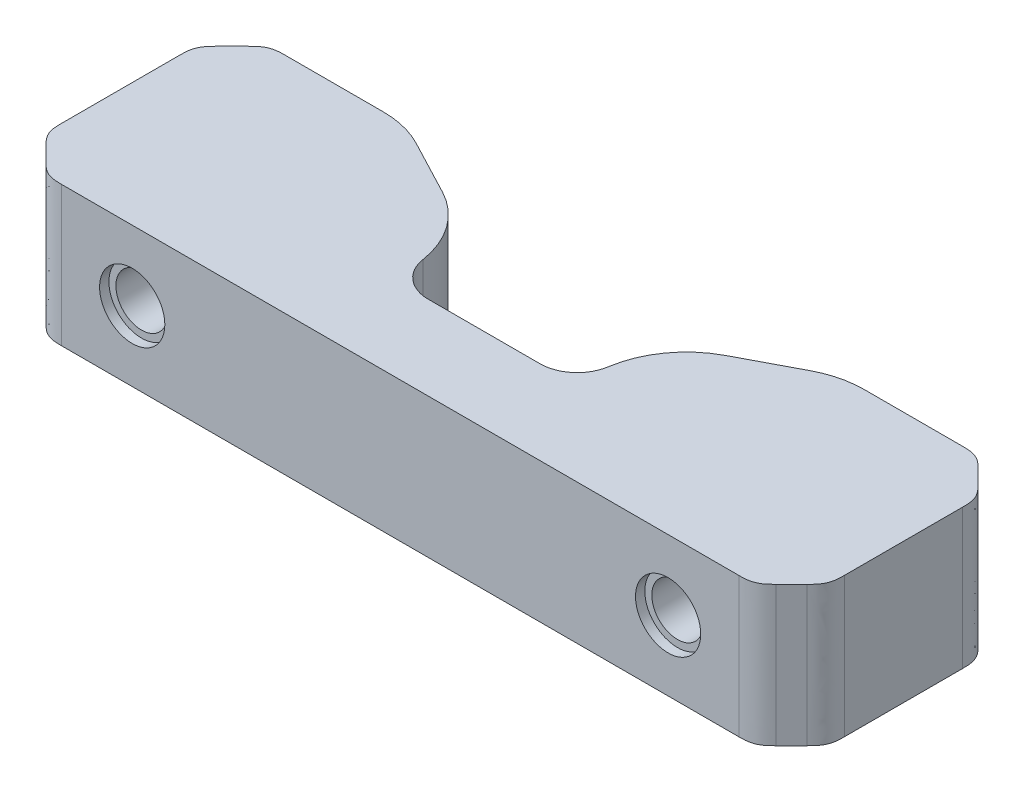
from build123d import *

# Parameters (mm, degrees)
ESQUISSE1_W                  = 20
ESQUISSE1_H                  = 12
BOSS_EXTRU_1_DEPTH           = 15
ESQUISSE1_4_R                = 4.2
ENL_V_MAT_EXTRU_1_DEPTH      = 12
CONG_2_R                     = 4
ENL_V_MAT_EXTRU_2_DEPTH      = 54.749418763
ENL_V_MAT_EXTRU_2_DEPTH_BACK = 10
ESQUISSE2_R                  = 2.75
ESQUISSE4_R                  = 3.5
ENL_V_MAT_EXTRU_3_DEPTH      = 1
ESQUISSE5_R                  = 3.5
ENL_V_MAT_EXTRU_4_DEPTH      = 1
ENL_V_MAT_EXTRU_5_DEPTH      = 49.093658782
CONG_3_R                     = 10


with BuildPart() as part:
    # Esquisse1 → Boss.-Extru.1 (new body)
    with BuildSketch(Plane(origin=(0, 0, 0), x_dir=(1, 0, 0), z_dir=(0, 1, 0))):
        Polygon((-38, 12), (-42, 8), (-42, -8), (-38, -12), (38, -12), (42, -8), (42, 8), (38, 12), (22, 12), (14, 18), (-14, 18), (-22, 12), align=None)
        with Locations((0, 3)):
            Rectangle(ESQUISSE1_W, ESQUISSE1_H, mode=Mode.SUBTRACT)
    extrude(amount=BOSS_EXTRU_1_DEPTH)

    # Congé1
    # a fillet whose section is not a circle: 4 mm, written as the material it adds along each edge
    with BuildSketch(Plane(origin=(22, 0, -12), x_dir=(1, 0, 0), z_dir=(0, 1, 0)), Plane(origin=(-22, 0, -12), x_dir=(0.7999999999999996, 0, -0.6000000000000003), z_dir=(0, 1, 0))) as cong_1_piece_1:
        with BuildLine():
            add(Edge.make_bspline([(1.333333333, 0), (1.087283439, 0), (0.841233545, 0), (0.292751215, 0.037020099), (-0.211988912, 0.205266808), (-0.672986836, 0.504740127), (-0.869826751, 0.652370064), (-1.066666667, 0.8)], knots=[0, 0, 0, 0, 0, 0, 0.5, 0.5, 1, 1, 1, 1, 1, 1], degree=5))
            Line((-1.066666667, 0.8), (0, 0))
            Line((0, 0), (1.333333333, 0))
        make_face()
    extrude(amount=15)
    # a fillet whose section is not a circle: 4 mm, written as the material it takes off along each edge
    with BuildSketch(Plane(origin=(42, -4.142135624, 8), x_dir=(-0.707106781186547, 0, 0.7071067811865481), z_dir=(0, 1, 0)), Plane(origin=(38, -4.142135624, 12), x_dir=(-1, 0, 0), z_dir=(0, 1, 0)), Plane(origin=(42, -4.142135624, -8), x_dir=(0, 0, 1), z_dir=(0, 1, 0)), Plane(origin=(38, -4.142135624, -12), x_dir=(0.7071067811865481, 0, 0.707106781186547), z_dir=(0, 1, 0)), Plane(origin=(-42, -4.142135624, -8), x_dir=(0.7071067811865475, 0, -0.7071067811865475), z_dir=(0, 1, 0)), Plane(origin=(-42, -4.142135624, 8), x_dir=(0, 0, -1), z_dir=(0, 1, 0)), Plane(origin=(-38, -4.142135624, 12), x_dir=(-0.7071067811865465, 0, -0.7071067811865486), z_dir=(0, 1, 0))) as cong_1_2_piece_1:
        with BuildLine():
            add(Edge.make_bspline([(1.656854249, 0), (1.35356905, 0), (1.050283851, 0), (0.373674798, -0.056927592), (-0.223974097, -0.30448187), (-0.742662833, -0.742662833), (-0.957117854, -0.957117854), (-1.171572875, -1.171572875)], knots=[0, 0, 0, 0, 0, 0, 0.5, 0.5, 1, 1, 1, 1, 1, 1], degree=5))
            Line((-1.171572875, -1.171572875), (0, 0))
            Line((0, 0), (1.656854249, 0))
        make_face()
    extrude(amount=23.284271247, mode=Mode.SUBTRACT)
    with BuildSketch(Plane(origin=(14, -3.333333333, -18), x_dir=(0.7999999999999996, 0, 0.6000000000000003), z_dir=(0, 1, 0)), Plane(origin=(-14, -3.333333333, -18), x_dir=(1, 0, 0), z_dir=(0, 1, 0))) as cong_1_2_piece_2:
        with BuildLine():
            add(Edge.make_bspline([(1.333333333, 0), (1.087283439, 0), (0.841233545, 0), (0.292751215, -0.037020099), (-0.211988912, -0.205266808), (-0.672986836, -0.504740127), (-0.869826751, -0.652370064), (-1.066666667, -0.8)], knots=[0, 0, 0, 0, 0, 0, 0.5, 0.5, 1, 1, 1, 1, 1, 1], degree=5))
            Line((-1.066666667, -0.8), (0, 0))
            Line((0, 0), (1.333333333, 0))
        make_face()
    extrude(amount=21.666666667, mode=Mode.SUBTRACT)
    with BuildSketch(Plane(origin=(-38, -4.142135624, -12), x_dir=(-0.7071067811865465, 0, 0.7071067811865486), z_dir=(0, 1, 0))) as cong_1_2_piece_3:
        with BuildLine():
            add(Edge.make_bspline([(1.656854249, 0), (1.35356905, 0), (1.050283851, 0), (0.373674798, 0.056927592), (-0.223974097, 0.30448187), (-0.742662833, 0.742662833), (-0.957117854, 0.957117854), (-1.171572875, 1.171572875)], knots=[0, 0, 0, 0, 0, 0, 0.5, 0.5, 1, 1, 1, 1, 1, 1], degree=5))
            Line((-1.171572875, 1.171572875), (0, 0))
            Line((0, 0), (1.656854249, 0))
        make_face()
    extrude(amount=23.284271247, mode=Mode.SUBTRACT)

    # Esquisse1<4> → Enlèv. mat.-Extru.1 (cut)
    with BuildSketch(Plane(origin=(0, 0, 0), x_dir=(1, 0, 0), z_dir=(0, 1, 0))):
        with Locations(Location((-30, 0, 0), (0, 0, 270))):
            Circle(ESQUISSE1_4_R)
        with Locations(Location((30, 0, 0), (0, 0, 270))):
            Circle(ESQUISSE1_4_R)
    extrude(amount=ENL_V_MAT_EXTRU_1_DEPTH, mode=Mode.SUBTRACT)

    # Congé2
    cong_2_edges = [part.edges().sort_by_distance(p)[0] for p in [
        (-10, 7.5, -9),
        (-10, 7.5, 3),
        (10, 7.5, 3),
        (10, 7.5, -9),
    ]]
    fillet(cong_2_edges, radius=CONG_2_R)

    # Esquisse2 → Enlèv. mat.-Extru.2 (cut, two sides: drawn at the far end of the back side and taken through both)
    with BuildSketch(Plane.XY.offset(12).offset(-ENL_V_MAT_EXTRU_2_DEPTH_BACK)):
        with Locations(Location((-28.75, 7.5, 0), (0, 0, 180))):
            Circle(ESQUISSE2_R)
        with Locations(Location((28.75, 7.5, 0), (0, 0, 180))):
            Circle(ESQUISSE2_R)
    extrude(amount=ENL_V_MAT_EXTRU_2_DEPTH + ENL_V_MAT_EXTRU_2_DEPTH_BACK, mode=Mode.SUBTRACT)

    # Esquisse4 → Enlèv. mat.-Extru.3 (cut)
    with BuildSketch(Plane.XY.offset(12)):
        with Locations((28.75, 7.5)):
            Circle(ESQUISSE4_R)
    extrude(amount=-ENL_V_MAT_EXTRU_3_DEPTH, mode=Mode.SUBTRACT)

    # Esquisse5 → Enlèv. mat.-Extru.4 (cut)
    with BuildSketch(Plane.XY.offset(12)):
        with Locations((-28.75, 7.5)):
            Circle(ESQUISSE5_R)
    extrude(amount=-ENL_V_MAT_EXTRU_4_DEPTH, mode=Mode.SUBTRACT)

    # Esquisse6 → Enlèv. mat.-Extru.5 (cut, through all)
    with BuildSketch(Plane.XZ):
        Polygon((-23.333333333, -12), (-10, -5), (10, -5), (23.333333333, -12), (23.333333333, -18), (-23.333333333, -18), align=None)
    extrude(amount=-ENL_V_MAT_EXTRU_5_DEPTH, mode=Mode.SUBTRACT)

    # Congé3
    cong_3_edges = [part.edges().sort_by_distance(p)[0] for p in [
        (-23.333333333, 7.5, -12),
        (-10, 7.5, -5),
        (10, 7.5, -5),
        (23.333333333, 7.5, -12),
    ]]
    fillet(cong_3_edges, radius=CONG_3_R)


solid = part.part
